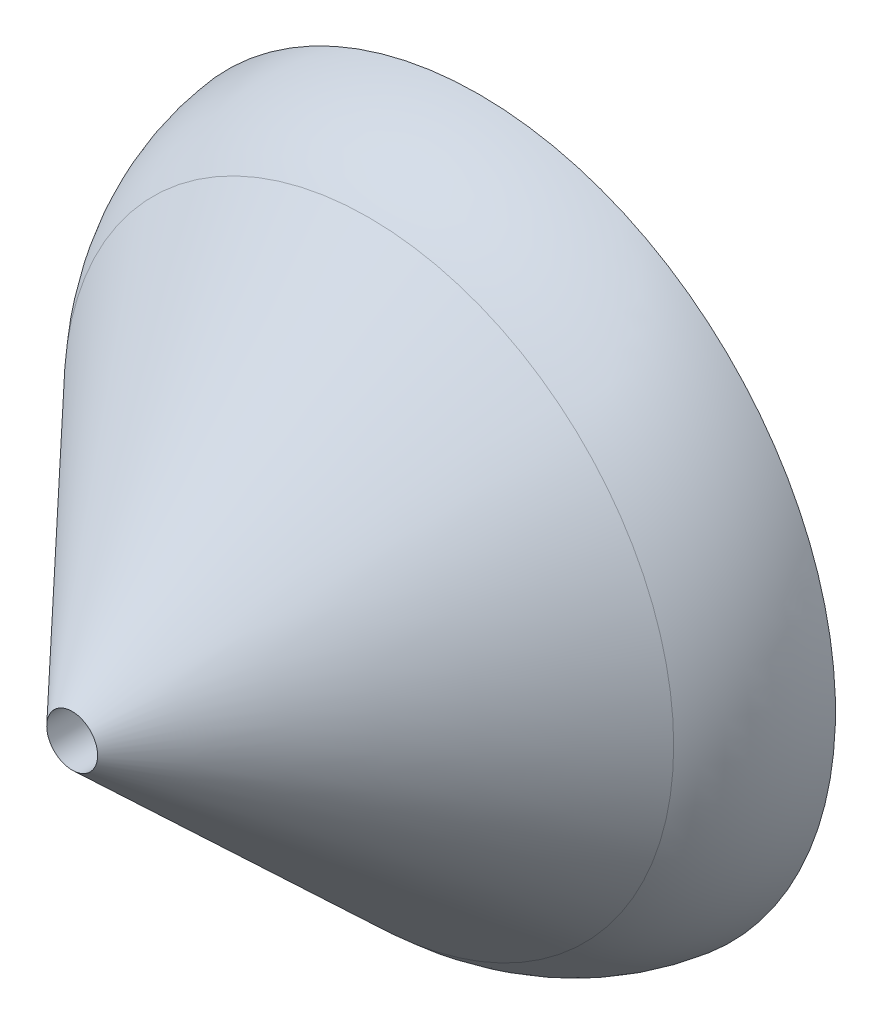
from build123d import *

# Parameters (mm, degrees)
FILLET1_R = 48.26


with BuildPart() as part:
    # Sketch2 → Revolve1 (revolve)
    with BuildSketch(Plane.YZ, mode=Mode.PRIVATE) as revolve1_sk:
        Polygon((-50.8, 0), (-50.8, 13.960488096), (-42.665643504, 22.596357665), (-6.35, 22.596357665), (-6.35, 35.296357665), (-30.703173869, 35.296357665), (-6.35, 61.150994506), (-6.35, 101.6), (-88.9, 13.960488096), (-88.9, 0), align=None)
    revolve(revolve1_sk.sketch.rotate(Axis((0, 0, 0), (0, 0, 1)), 180), axis=Axis((0, 0, 0), (0, 0, 1)))

    # Fillet1
    # the kernel refuses this fillet: 48.26 mm, written as the material it takes off along each edge
    with BuildSketch(Plane(origin=(0, 0, 13.960488096), x_dir=(0, 1, 0), z_dir=(1, 0, 0))) as fillet1_piece_1:
        with BuildLine():
            CenterArc((40.957476315, -19.486971855), FILLET1_R, 6.575639672, 36.71144238)
            Line((88.9, -13.960488096), (89.858850474, -13.849958421))
            ThreePointArc((89.858850474, -13.849958421), (89.8652, -6.980244048), (89.8652, 0))
            Line((89.8652, 0), (89.602595492, 0.661793483))
            Line((89.602595492, 0.661793483), (76.789846407, 14.264495797))
            Line((76.789846407, 14.264495797), (76.087250915, 13.602702313))
        make_face()
    revolve(axis=Axis((0, 0, 13.960488096), (0, 0, 1)), mode=Mode.SUBTRACT)


solid = part.part
